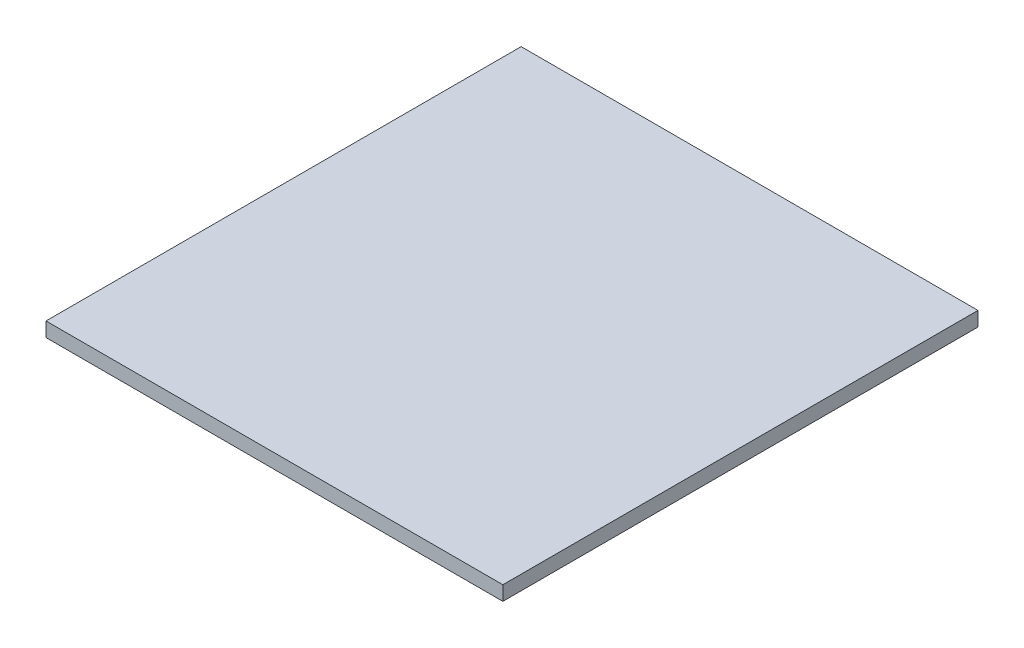
from build123d import *

# Parameters (mm, degrees)
SKETCH1_W           = 95
SKETCH1_H           = 98.8
BOSS_EXTRUDE1_DEPTH = 3


with BuildPart() as part:
    # Sketch1 → Boss-Extrude1 (new body)
    with BuildSketch(Plane(origin=(0, 0, 0), x_dir=(1, 0, 0), z_dir=(0, 1, 0))):
        with Locations((3.218457944, -28.701985981)):
            Rectangle(SKETCH1_W, SKETCH1_H)
    extrude(amount=BOSS_EXTRUDE1_DEPTH)


solid = part.part
